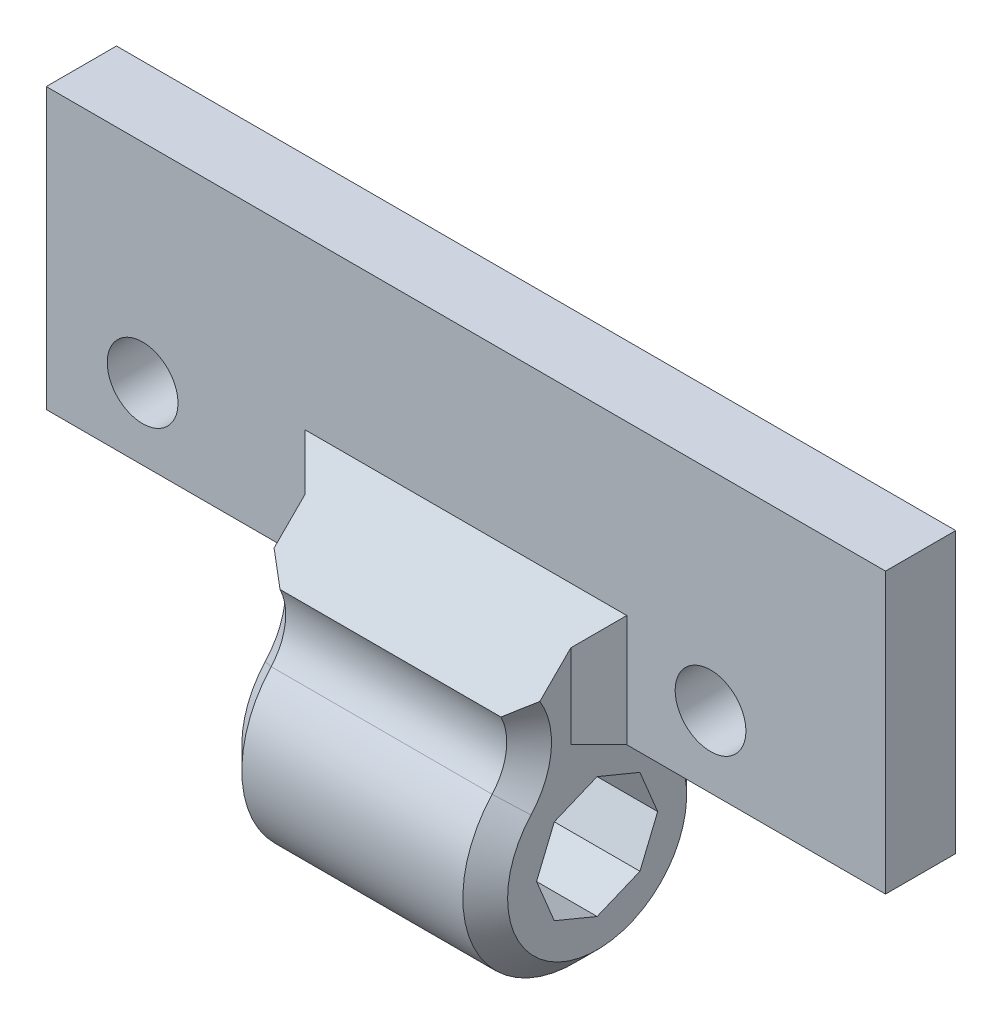
from build123d import *

# Parameters (mm, degrees)
SKETCH1_W           = 30
SKETCH1_H           = 10
SKETCH1_R           = 1.264247842
BOSS_EXTRUDE1_DEPTH = 5
SKETCH3_R           = 4
BOSS_EXTRUDE2_DEPTH = 4.75
FILLET1_R           = 2
FILLET2_R           = 2
CHAMFER1_SIZE       = 0.8
CUT_EXTRUDE3_REACH  = 34.298
SKETCH6_W           = 3.842122027
SKETCH6_H           = 10
CHAMFER4_START      = 10.25
CHAMFER4_DEPTH      = 9.5
CHAMFER5_SIZE       = 1


with BuildPart() as part:
    # Sketch1 → Boss-Extrude1 (new body)
    with BuildSketch(Plane.XY):
        with Locations((15, 5)):
            Rectangle(SKETCH1_W, SKETCH1_H)
        with Locations((3.444076375, 2.55)):
            Circle(SKETCH1_R, mode=Mode.SUBTRACT)
        with Locations((23.744076375, 2.55)):
            Circle(SKETCH1_R, mode=Mode.SUBTRACT)
    extrude(amount=BOSS_EXTRUDE1_DEPTH)

    # Sketch3 → Boss-Extrude2 (add, symmetric)
    with BuildSketch(Plane.ZY.offset(-15)):
        with Locations((2.568998912, -3.622468738)):
            Circle(SKETCH3_R)
        Polygon((0.404214511, -3.622468738), (1.038265182, -5.153202468), (2.568998912, -5.787253139), (4.099732641, -5.153202468), (4.733783312, -3.622468738), (4.099732641, -2.091735009), (2.568998912, -1.457684338), (1.038265182, -2.091735009), align=None, mode=Mode.SUBTRACT)
    extrude(amount=BOSS_EXTRUDE2_DEPTH, both=True)

    # Fillet1
    # the kernel refuses this fillet: 2 mm, written as the material it adds along each edge
    with BuildSketch(Plane(origin=(19.75, 0, 0.872614451), x_dir=(0, 0, -1), z_dir=(-1, 0, 0))) as fillet1_piece_1:
        with BuildLine():
            CenterArc((2.851261839, -0.291469576), FILLET1_R, 139.283020083, 32.337148469)
            ThreePointArc((1.335379739, 1.013176529), (0.721358104, 0.435852839), (0, 0))
            Line((0, 0), (0.872614451, 0))
        make_face()
    extrude(amount=9.5)
    with BuildSketch(Plane(origin=(19.75, 0, 4.265383373), x_dir=(0, 0, 1), z_dir=(-1, 0, 0))) as fillet1_piece_2:
        with BuildLine():
            CenterArc((2.674069858, 0.488386288), FILLET1_R, 194.13415607, 29.112659272)
            ThreePointArc((1.217251752, -0.881898721), (0.650423795, -0.383257259), (0, 0))
            Line((0, 0), (0.734616627, 0))
        make_face()
    extrude(amount=9.5)

    # Fillet2
    # the kernel refuses this fillet: 2 mm, written as the material it adds along each edge
    with BuildSketch(Plane(origin=(19.75, 0, 0), x_dir=(0, 1, 0), z_dir=(-1, 0, 0))) as fillet2_piece_1:
        with BuildLine():
            CenterArc((0.266521997, 2), FILLET2_R, 229.596597584, 40.403402416)
            Line((-1.029808248, 0.477000363), (-1.159441272, 0.324700399))
            ThreePointArc((-1.159441272, 0.324700399), (-1.143641139, 0.311177078), (-0.029146958, -0.197864739))
            Line((-0.029146958, -0.197864739), (0, -0.2))
            Line((0, -0.2), (0.266521997, -0.2))
            Line((0.266521997, -0.2), (0.266521997, 0))
        make_face()
    extrude(amount=9.5)
    with BuildSketch(Plane(origin=(19.75, 0, 5), x_dir=(0, -0.870596677984774, 0.491997382393317), z_dir=(-1, 0, 0))) as fillet2_piece_2:
        with BuildLine():
            CenterArc((0.615688034, 1.949333304), FILLET2_R, 240.528051524, 42.396189725)
            Line((-0.368306731, 0.208139948), (-0.466706207, 0.034020613))
            Line((-0.466706207, 0.034020613), (-0.098399476, -0.174119336))
            Line((-0.098399476, -0.174119336), (-0.052901843, -0.192876631))
            ThreePointArc((-0.052901843, -0.192876631), (1.052854803, -0.20795909), (1.10774555, -0.19493333))
            Line((1.10774555, -0.19493333), (1.063013048, 0))
        make_face()
    extrude(amount=9.5)

    # Chamfer1
    # the kernel refuses this chamfer: 0.8 mm, written as the material it takes off along each edge
    with BuildSketch(Plane(origin=(19.75, 0.266521997, -2), x_dir=(0, -0.648165122631187, 0.7614998186503384), z_dir=(0, -0.7614998186503384, -0.648165122631187))) as chamfer1_piece_1_section:
        Polygon((2, CHAMFER1_SIZE), (2 + CHAMFER1_SIZE, 0), (2, 0), align=None)
    chamfer1_piece_1 = revolve(axis=Axis((19.75, 0.266521997, -2), (-1, 0, 0)), revolution_arc=99.346805501, mode=Mode.PRIVATE)
    chamfer1_piece_1 = split(chamfer1_piece_1, bisect_by=Plane(origin=(19.75, 0, -2), z_dir=(0, -1, 0)), keep=Keep.TOP, mode=Mode.PRIVATE)
    add(chamfer1_piece_1, mode=Mode.SUBTRACT)
    with BuildSketch(Plane(origin=(19.75, 0.266521997, -2), x_dir=(0, -0.648165122631187, 0.7614998186503384), z_dir=(0, -0.7614998186503384, -0.648165122631187))) as chamfer1_piece_2_section:
        Polygon((2, CHAMFER1_SIZE), (2 + CHAMFER1_SIZE, 0), (2, 0), align=None)
    chamfer1_piece_2 = revolve(axis=Axis((19.75, 0.266521997, -2), (-1, 0, 0)), revolution_arc=99.346805501, mode=Mode.PRIVATE)
    chamfer1_piece_2 = split(chamfer1_piece_2, bisect_by=Plane(origin=(19.75, 0.266521997, 0), z_dir=(0, 0, -1)), keep=Keep.TOP, mode=Mode.PRIVATE)
    add(chamfer1_piece_2, mode=Mode.SUBTRACT)
    with BuildSketch(Plane(origin=(19.75, 0.423050926, 7), x_dir=(0, 0.8566624684959867, -0.515877325602088), z_dir=(0, 0.515877325602088, 0.8566624684959867))) as chamfer1_piece_3_section:
        Polygon((2, CHAMFER1_SIZE), (2 + CHAMFER1_SIZE, 0), (2, 0), align=None)
    chamfer1_piece_3 = revolve(axis=Axis((19.75, 0.423050926, 7), (-1, 0, 0)), revolution_arc=101.340075028, mode=Mode.PRIVATE)
    chamfer1_piece_3 = split(chamfer1_piece_3, bisect_by=Plane(origin=(19.75, 0, 7), z_dir=(0, -1, 0)), keep=Keep.TOP, mode=Mode.PRIVATE)
    add(chamfer1_piece_3, mode=Mode.SUBTRACT)
    with BuildSketch(Plane(origin=(19.75, 0.423050926, 7), x_dir=(0, 0.8566624684959867, -0.515877325602088), z_dir=(0, 0.515877325602088, 0.8566624684959867))) as chamfer1_piece_4_section:
        Polygon((2, CHAMFER1_SIZE), (2 + CHAMFER1_SIZE, 0), (2, 0), align=None)
    chamfer1_piece_4 = revolve(axis=Axis((19.75, 0.423050926, 7), (-1, 0, 0)), revolution_arc=101.340075028, mode=Mode.PRIVATE)
    chamfer1_piece_4 = split(chamfer1_piece_4, bisect_by=Plane(origin=(19.75, 0.423050926, 5), z_dir=(0, 0, 1)), keep=Keep.TOP, mode=Mode.PRIVATE)
    add(chamfer1_piece_4, mode=Mode.SUBTRACT)
    with BuildSketch(Plane(origin=(19.75, -3.622468738, 2.568998912), x_dir=(0, 0.6742532774459821, 0.7385001813495726), z_dir=(0, 0.7385001813495726, -0.6742532774459821))) as chamfer1_piece_5:
        Polygon((4 - CHAMFER1_SIZE, 0), (4, -CHAMFER1_SIZE), (4, 0), align=None)
    revolve(axis=Axis((19.75, -3.622468738, 2.568998912), (1, 0, 0)), revolution_arc=262.799592141, mode=Mode.SUBTRACT)
    with BuildSketch(Plane(origin=(10.25, 0.266521997, -2), x_dir=(0, -0.648165122631187, 0.7614998186503384), z_dir=(0, -0.7614998186503384, -0.648165122631187))) as chamfer1_piece_6_section:
        Polygon((2 + CHAMFER1_SIZE, 0), (2, -CHAMFER1_SIZE), (2, 0), align=None)
    chamfer1_piece_6 = revolve(axis=Axis((10.25, 0.266521997, -2), (-1, 0, 0)), revolution_arc=99.346805501, mode=Mode.PRIVATE)
    chamfer1_piece_6 = split(chamfer1_piece_6, bisect_by=Plane(origin=(10.25, 0, -2), z_dir=(0, -1, 0)), keep=Keep.TOP, mode=Mode.PRIVATE)
    add(chamfer1_piece_6, mode=Mode.SUBTRACT)
    with BuildSketch(Plane(origin=(10.25, 0.266521997, -2), x_dir=(0, -0.648165122631187, 0.7614998186503384), z_dir=(0, -0.7614998186503384, -0.648165122631187))) as chamfer1_piece_7_section:
        Polygon((2 + CHAMFER1_SIZE, 0), (2, -CHAMFER1_SIZE), (2, 0), align=None)
    chamfer1_piece_7 = revolve(axis=Axis((10.25, 0.266521997, -2), (-1, 0, 0)), revolution_arc=99.346805501, mode=Mode.PRIVATE)
    chamfer1_piece_7 = split(chamfer1_piece_7, bisect_by=Plane(origin=(10.25, 0.266521997, 0), z_dir=(0, 0, -1)), keep=Keep.TOP, mode=Mode.PRIVATE)
    add(chamfer1_piece_7, mode=Mode.SUBTRACT)
    with BuildSketch(Plane(origin=(10.25, 0.423050926, 7), x_dir=(0, 0.8566624684959867, -0.515877325602088), z_dir=(0, 0.515877325602088, 0.8566624684959867))) as chamfer1_piece_8_section:
        Polygon((2, -CHAMFER1_SIZE), (2 + CHAMFER1_SIZE, 0), (2, 0), align=None)
    chamfer1_piece_8 = revolve(axis=Axis((10.25, 0.423050926, 7), (-1, 0, 0)), revolution_arc=101.340075028, mode=Mode.PRIVATE)
    chamfer1_piece_8 = split(chamfer1_piece_8, bisect_by=Plane(origin=(10.25, 0, 7), z_dir=(0, -1, 0)), keep=Keep.TOP, mode=Mode.PRIVATE)
    add(chamfer1_piece_8, mode=Mode.SUBTRACT)
    with BuildSketch(Plane(origin=(10.25, 0.423050926, 7), x_dir=(0, 0.8566624684959867, -0.515877325602088), z_dir=(0, 0.515877325602088, 0.8566624684959867))) as chamfer1_piece_9_section:
        Polygon((2, -CHAMFER1_SIZE), (2 + CHAMFER1_SIZE, 0), (2, 0), align=None)
    chamfer1_piece_9 = revolve(axis=Axis((10.25, 0.423050926, 7), (-1, 0, 0)), revolution_arc=101.340075028, mode=Mode.PRIVATE)
    chamfer1_piece_9 = split(chamfer1_piece_9, bisect_by=Plane(origin=(10.25, 0.423050926, 5), z_dir=(0, 0, 1)), keep=Keep.TOP, mode=Mode.PRIVATE)
    add(chamfer1_piece_9, mode=Mode.SUBTRACT)
    with BuildSketch(Plane(origin=(10.25, -3.622468738, 2.568998912), x_dir=(0, 0.6742532774459821, 0.7385001813495726), z_dir=(0, 0.7385001813495726, -0.6742532774459821))) as chamfer1_piece_10:
        Polygon((4 - CHAMFER1_SIZE, 0), (4, CHAMFER1_SIZE), (4, 0), align=None)
    revolve(axis=Axis((10.25, -3.622468738, 2.568998912), (1, 0, 0)), revolution_arc=262.799592141, mode=Mode.SUBTRACT)

    # Cut-Extrude3: up to this face of the body (flat: up to its plane)
    cut_extrude3_end = Plane(part.part.faces().sort_by_distance((30, 5, 2.5))[0])
    # Sketch6 → Cut-Extrude3 (cut, up to the picked face)
    with BuildSketch(Plane(origin=(0, 0, 0), x_dir=(0, 0, -1), z_dir=(1, 0, 0)), mode=Mode.PRIVATE) as cut_extrude3_sk1:
        with Locations((-4.430776166, 5)):
            Rectangle(SKETCH6_W, SKETCH6_H)
    cut_extrude3_tool1 = split(extrude(cut_extrude3_sk1.sketch, amount=CUT_EXTRUDE3_REACH, mode=Mode.PRIVATE), bisect_by=cut_extrude3_end, keep=Keep.BOTH, mode=Mode.PRIVATE)
    add(cut_extrude3_tool1.solids().sort_by(Axis((0, 5, 4.430776), (1, 0, 0)))[0], mode=Mode.SUBTRACT)

    # Chamfer4: read off the stored shape, not the designer's step
    # Chamfer4 outline → Chamfer4 (add)
    with BuildSketch(Plane.YZ.offset(CHAMFER4_START)):
        with BuildLine():
            ThreePointArc((1.304835295, 5.204879857), (0.665907086, 5.014799535), (0, 5.045255026))
            Line((0, 5.045255026), (0, 2.509715152))
            Line((0, 2.509715152), (4, 2.509715152))
            Line((4, 2.509715152), (1.304835295, 5.204879857))
        make_face()
    extrude(amount=CHAMFER4_DEPTH)

    # Chamfer4 2 outline → Chamfer4 2 (revolve, cut)
    with BuildSketch(Plane(origin=(0, 0.423050926, 7), x_dir=(0, 1, 0), z_dir=(0, 0, -1))):
        Polygon((2, 19.75), (2, 18.95), (2.8, 19.75), align=None)
        Polygon((2.8, 10.25), (2, 11.05), (2, 10.25), align=None)
    revolve(axis=Axis((0, 0.423050926, 7), (1, 0, 0)), mode=Mode.SUBTRACT)

    # Chamfer5
    chamfer5_edges = [part.edges().sort_by_distance(p)[0] for p in [
        (19.75, 2, 2.509715152),
        (10.25, 2, 2.509715152),
    ]]
    chamfer(chamfer5_edges, length=CHAMFER5_SIZE)


solid = part.part
